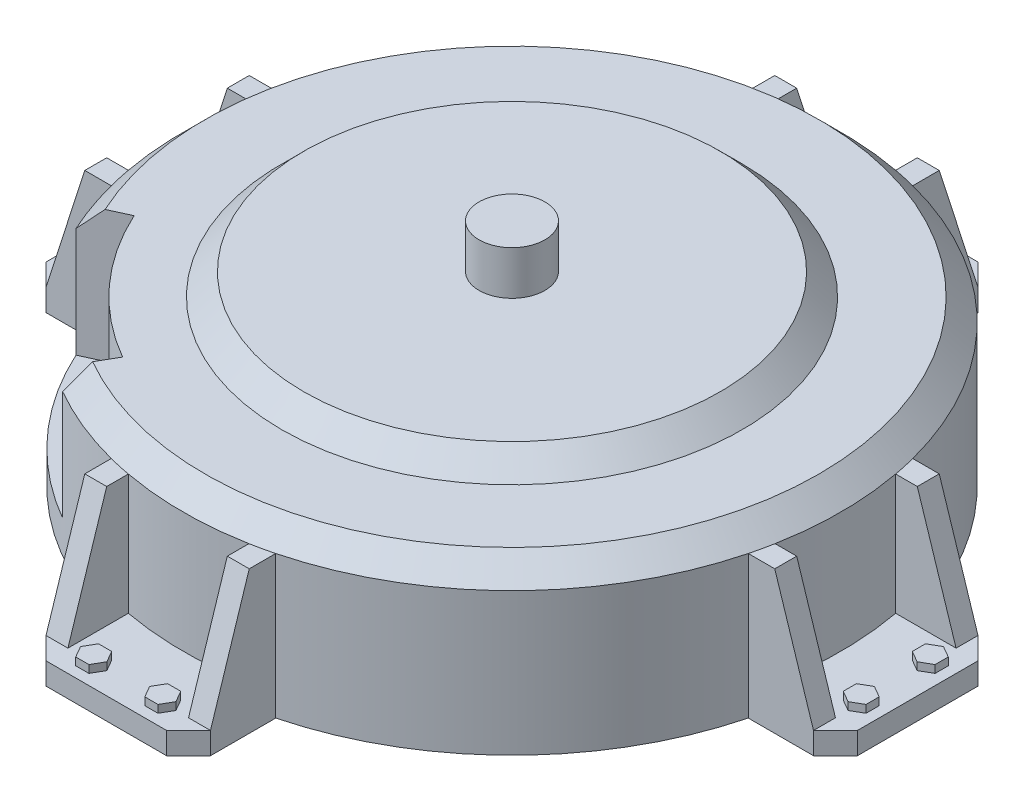
from build123d import *

# Parameters (mm, degrees)
SKETCH1_R                    = 150
BOSS_EXTRUDE1_DEPTH          = 75
CHAMFER1_SIZE                = 10
BOSS_EXTRUDE2_DEPTH          = 10
CHAMFER2_SIZE                = 10
BOSS_EXTRUDE3_DEPTH          = 10
BOSS_EXTRUDE4_DEPTH          = 3.5
CIRPATTERN1_COUNT            = 4
CIRPATTERN1_COPY_1_DEPTH     = 10
CIRPATTERN1_COPY_2_DEPTH     = 10
CIRPATTERN1_COPY_3_DEPTH     = 10
CIRPATTERN1_COPY_4_DEPTH     = 3.5
CIRPATTERN1_COPY_5_DEPTH     = 3.5
CIRPATTERN1_COPY_6_DEPTH     = 3.5
CHAMFER2_OF_CIRPATTERN1_SIZE = 10
CUT_EXTRUDE2_START           = -60
CUT_EXTRUDE2_DEPTH           = 60
SKETCH6_R                    = 110
BOSS_EXTRUDE5_DEPTH          = 10
CHAMFER3_SIZE                = 15
SKETCH7_R                    = 15
BOSS_EXTRUDE6_DEPTH          = 20


with BuildPart() as part:
    # Sketch1 → Boss-Extrude1 (new body)
    with BuildSketch(Plane(origin=(0, 0, 0), x_dir=(1, 0, 0), z_dir=(0, 1, 0))):
        with Locations(Location((0, 0, 0), (0, 0, 270))):
            Circle(SKETCH1_R)
    extrude(amount=BOSS_EXTRUDE1_DEPTH)

    # Chamfer1
    chamfer1_edges = [part.edges().sort_by_distance(p)[0] for p in [
        (0, 75, -150),
    ]]
    chamfer(chamfer1_edges, length=CHAMFER1_SIZE)

    # Sketch2 → Boss-Extrude2 (add)
    with BuildSketch(Plane.XZ):
        with BuildLine():
            Line((-145.236875483, 37.5), (-185, 37.5))
            Line((-185, 37.5), (-185, -37.5))
            Line((-185, -37.5), (-145.236875483, -37.5))
            ThreePointArc((-145.236875483, -37.5), (-150, 0), (-145.236875483, 37.5))
        make_face()
    boss_extrude2 = extrude(amount=-BOSS_EXTRUDE2_DEPTH)

    # Chamfer2
    chamfer2_edges = [part.edges().sort_by_distance(p)[0] for p in [
        (-185, 5, -37.5),
        (-185, 5, 37.5),
    ]]
    chamfer(chamfer2_edges, length=CHAMFER2_SIZE)

    # Sketch3 → Boss-Extrude3 (add)
    with BuildSketch(Plane.XY.offset(37.5)):
        Polygon((-145.236875483, 10), (-145.236875483, 65), (-157.32, 65), (-175, 10), align=None)
    boss_extrude3 = extrude(amount=-BOSS_EXTRUDE3_DEPTH)

    # Sketch4 → Boss-Extrude4 (add)
    with BuildSketch(Plane(origin=(0, 10, 0), x_dir=(1, 0, 0), z_dir=(0, 1, 0))):
        Polygon((-175, -21.74912957), (-169.803847577, -18.74912957), (-169.803847577, -12.74912957), (-175, -9.74912957), (-180.196152423, -12.74912957), (-180.196152423, -18.74912957), align=None)
    boss_extrude4 = extrude(amount=BOSS_EXTRUDE4_DEPTH)

    # Mirror1: Boss-Extrude3, Boss-Extrude4 across plane
    add(boss_extrude3.mirror(Plane.XY))
    add(boss_extrude4.mirror(Plane.XY))

    # CirPattern1: Boss-Extrude2, Boss-Extrude3, Boss-Extrude4 ×4 about axis
    cirpattern1_axis = Axis((0, 0, 0), (0, 1, 0))
    add([boss_extrude2.rotate(cirpattern1_axis, i * 360 / CIRPATTERN1_COUNT) for i in range(1, CIRPATTERN1_COUNT)])
    add([boss_extrude3.rotate(cirpattern1_axis, i * 360 / CIRPATTERN1_COUNT) for i in range(1, CIRPATTERN1_COUNT)])
    add([boss_extrude4.rotate(cirpattern1_axis, i * 360 / CIRPATTERN1_COUNT) for i in range(1, CIRPATTERN1_COUNT)])

    # CirPattern1 copy 1 sketch → CirPattern1 copy 1 (add)
    with BuildSketch(Plane(origin=(-37.5, 0, 0), x_dir=(0, 0, -1), z_dir=(-1, 0, 0))):
        Polygon((-145.236875483, -10), (-145.236875483, -65), (-157.32, -65), (-175, -10), align=None)
    extrude(amount=-CIRPATTERN1_COPY_1_DEPTH)

    # CirPattern1 copy 2 sketch → CirPattern1 copy 2 (add)
    with BuildSketch(Plane(origin=(0, 0, 37.5), x_dir=(-1, 0, 0), z_dir=(0, 0, 1))):
        Polygon((-145.236875483, -10), (-145.236875483, -65), (-157.32, -65), (-175, -10), align=None)
    extrude(amount=-CIRPATTERN1_COPY_2_DEPTH)

    # CirPattern1 copy 3 sketch → CirPattern1 copy 3 (add)
    with BuildSketch(Plane(origin=(37.5, 0, 0), x_dir=(0, 0, 1), z_dir=(1, 0, 0))):
        Polygon((-145.236875483, -10), (-145.236875483, -65), (-157.32, -65), (-175, -10), align=None)
    extrude(amount=-CIRPATTERN1_COPY_3_DEPTH)

    # CirPattern1 copy 4 sketch → CirPattern1 copy 4 (add)
    with BuildSketch(Plane(origin=(0, 10, 0), x_dir=(0, 0, -1), z_dir=(0, 1, 0))):
        Polygon((-175, 21.74912957), (-169.803847577, 18.74912957), (-169.803847577, 12.74912957), (-175, 9.74912957), (-180.196152423, 12.74912957), (-180.196152423, 18.74912957), align=None)
    extrude(amount=CIRPATTERN1_COPY_4_DEPTH)

    # CirPattern1 copy 5 sketch → CirPattern1 copy 5 (add)
    with BuildSketch(Plane(origin=(0, 10, 0), x_dir=(-1, 0, 0), z_dir=(0, 1, 0))):
        Polygon((-175, 21.74912957), (-169.803847577, 18.74912957), (-169.803847577, 12.74912957), (-175, 9.74912957), (-180.196152423, 12.74912957), (-180.196152423, 18.74912957), align=None)
    extrude(amount=CIRPATTERN1_COPY_5_DEPTH)

    # CirPattern1 copy 6 sketch → CirPattern1 copy 6 (add)
    with BuildSketch(Plane.ZX.offset(10)):
        Polygon((-175, 21.74912957), (-169.803847577, 18.74912957), (-169.803847577, 12.74912957), (-175, 9.74912957), (-180.196152423, 12.74912957), (-180.196152423, 18.74912957), align=None)
    extrude(amount=CIRPATTERN1_COPY_6_DEPTH)

    # Chamfer2 of CirPattern1
    chamfer2_of_cirpattern1_edges = [part.edges().sort_by_distance(p)[0] for p in [
        (-37.5, 5, 185),
        (37.5, 5, 185),
        (185, 5, 37.5),
        (185, 5, -37.5),
        (37.5, 5, -185),
        (-37.5, 5, -185),
    ]]
    chamfer(chamfer2_of_cirpattern1_edges, length=CHAMFER2_OF_CIRPATTERN1_SIZE)

    # Sketch5 → Cut-Extrude2 (cut)
    with BuildSketch(Plane(origin=(0, 75, 0), x_dir=(1, 0, 0), z_dir=(0, 1, 0)).offset(CUT_EXTRUDE2_START)):
        with BuildLine():
            ThreePointArc((-70, -121.24355653), (-103.548353297, -94.221751891), (-127.293055267, -58.279310916))
            Line((-127.293055267, -58.279310916), (-136.385416357, -62.442118839))
            ThreePointArc((-136.385416357, -62.442118839), (-110.944664247, -100.951877026), (-75, -129.903810568))
            Line((-75, -129.903810568), (-70, -121.24355653))
        make_face()
        with BuildLine():
            ThreePointArc((-65, -112.583302492), (-96.152042347, -87.491626756), (-118.200694176, -54.116502994))
            Line((-118.200694176, -54.116502994), (-127.293055267, -58.279310916))
            ThreePointArc((-127.293055267, -58.279310916), (-103.548353297, -94.221751891), (-70, -121.24355653))
            Line((-70, -121.24355653), (-65, -112.583302492))
        make_face()
    extrude(amount=CUT_EXTRUDE2_DEPTH, mode=Mode.SUBTRACT)

    # Sketch6 → Boss-Extrude5 (add)
    with BuildSketch(Plane(origin=(0, 75, 0), x_dir=(1, 0, 0), z_dir=(0, 1, 0))):
        with Locations(Location((0, 0, 0), (0, 0, 270))):
            Circle(SKETCH6_R)
    extrude(amount=BOSS_EXTRUDE5_DEPTH)

    # Chamfer3
    # the kernel refuses this chamfer: 15 mm, written as the material it takes off along each edge
    with BuildSketch(Plane(origin=(0, 85, 0), x_dir=(0, 0, 1), z_dir=(-1, 0, 0))) as chamfer3_piece_1_section:
        Polygon((110, -CHAMFER3_SIZE), (110 - CHAMFER3_SIZE, 0), (110, 0), align=None)
    chamfer3_piece_1 = revolve(axis=Axis((0, 85, 0), (0, 1, 0)), mode=Mode.PRIVATE)
    chamfer3_piece_1 = split(chamfer3_piece_1, bisect_by=Plane(origin=(0, 75, -100.081022807), z_dir=(0, 1, 0)), keep=Keep.TOP, mode=Mode.PRIVATE)
    add(chamfer3_piece_1, mode=Mode.SUBTRACT)

    # Sketch7 → Boss-Extrude6 (add)
    with BuildSketch(Plane(origin=(0, 85, 0), x_dir=(1, 0, 0), z_dir=(0, 1, 0))):
        with Locations(Location((0, 0, 0), (0, 0, 270))):
            Circle(SKETCH7_R)
    extrude(amount=BOSS_EXTRUDE6_DEPTH)


solid = part.part
